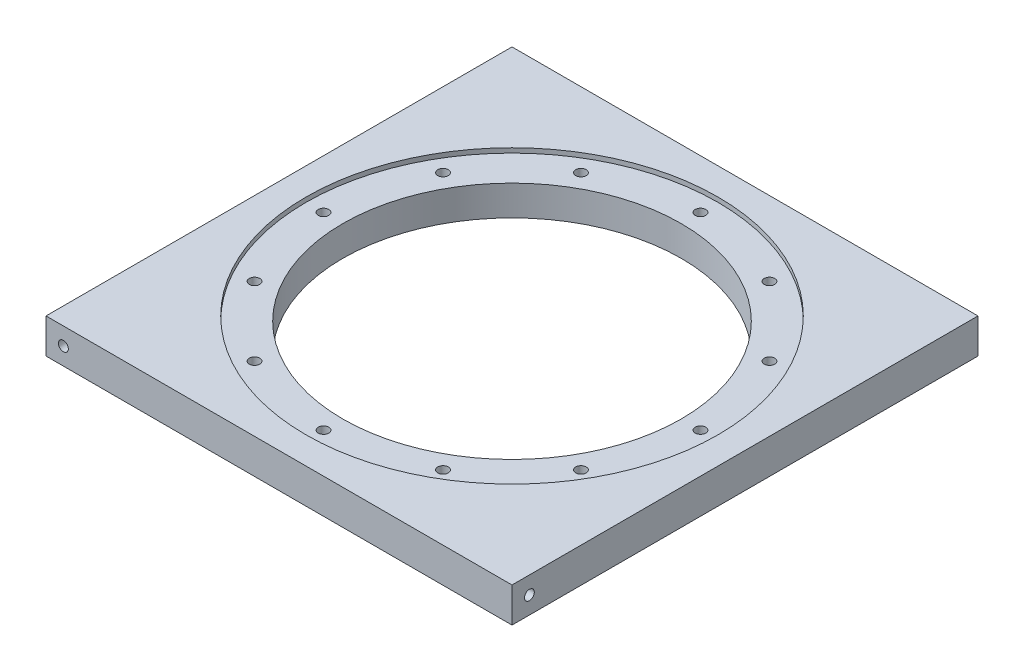
from build123d import *

# Parameters (mm, degrees)
SKETCH1_W           = 127.635
SKETCH1_H           = 127.635
BOSS_EXTRUDE1_DEPTH = 9.525
SKETCH6_R           = 1.35255
F_6_32_HOLE1_DEPTH  = 12.7
SKETCH7_R           = 1.35255
F_6_32_HOLE2_DEPTH  = 12.7
SKETCH8_R           = 1.35255
F_6_32_HOLE3_DEPTH  = 12.7
SKETCH9_R           = 1.35255
F_6_32_HOLE4_DEPTH  = 12.7
CUT_EXTRUDE1_DEPTH  = 9.525
SKETCH11_R          = 1.4351
CUT_EXTRUDE3_DEPTH  = 181.754286464
CIRPATTERN1_COUNT   = 12
SKETCH12_R          = 56.41975
CUT_EXTRUDE4_DEPTH  = 1.27


with BuildPart() as part:
    # Sketch1 → Boss-Extrude1 (new body)
    with BuildSketch(Plane(origin=(0, 0, 0), x_dir=(1, 0, 0), z_dir=(0, 1, 0))):
        with Locations((63.8175, 63.8175)):
            Rectangle(SKETCH1_W, SKETCH1_H)
    extrude(amount=BOSS_EXTRUDE1_DEPTH)

    # Sketch6 → 6-32 hole1 (cut)
    with BuildSketch(Plane(origin=(127.635, 0, 0), x_dir=(0, 0, -1), z_dir=(1, 0, 0))):
        with Locations((4.7625, 4.7625)):
            Circle(SKETCH6_R)
    extrude(amount=-F_6_32_HOLE1_DEPTH, mode=Mode.SUBTRACT)

    # Sketch7 → 6-32 hole2 (cut)
    with BuildSketch(Plane(origin=(0, 0, -127.635), x_dir=(-1, 0, 0), z_dir=(0, 0, -1))):
        with Locations((-122.8725, 4.7625)):
            Circle(SKETCH7_R)
    extrude(amount=-F_6_32_HOLE2_DEPTH, mode=Mode.SUBTRACT)

    # Sketch8 → 6-32 hole3 (cut)
    with BuildSketch(Plane.ZY):
        with Locations((-122.8725, 4.7625)):
            Circle(SKETCH8_R)
    extrude(amount=-F_6_32_HOLE3_DEPTH, mode=Mode.SUBTRACT)

    # Sketch9 → 6-32 hole4 (cut)
    with BuildSketch(Plane.XY):
        with Locations((4.7625, 4.7625)):
            Circle(SKETCH9_R)
    extrude(amount=-F_6_32_HOLE4_DEPTH, mode=Mode.SUBTRACT)

    # Sketch5 → Cut-Extrude1 (cut)
    with BuildSketch(Plane(origin=(0, 9.525, 0), x_dir=(1, 0, 0), z_dir=(0, 1, 0))):
        with BuildLine():
            ThreePointArc((63.8175, 110.1725), (17.4625, 63.8175), (63.8175, 17.4625))
            Line((63.8175, 17.4625), (63.8175, 110.1725))
        make_face()
        with BuildLine():
            Line((63.8175, 110.1725), (63.8175, 17.4625))
            ThreePointArc((63.8175, 17.4625), (96.595434842, 31.039565158), (110.1725, 63.8175))
            ThreePointArc((110.1725, 63.8175), (96.595434842, 96.595434842), (63.8175, 110.1725))
        make_face()
        with BuildLine():
            ThreePointArc((63.8175, 110.1725), (17.4625, 63.8175), (63.8175, 17.4625))
            Line((63.8175, 17.4625), (63.8175, 110.1725))
        make_face()
        with BuildLine():
            Line((63.8175, 110.1725), (63.8175, 17.4625))
            ThreePointArc((63.8175, 17.4625), (96.595434842, 31.039565158), (110.1725, 63.8175))
            ThreePointArc((110.1725, 63.8175), (96.595434842, 96.595434842), (63.8175, 110.1725))
        make_face()
    extrude(amount=-CUT_EXTRUDE1_DEPTH, mode=Mode.SUBTRACT)

    # Sketch11 → Cut-Extrude3 (cut, through all)
    with BuildSketch(Plane(origin=(0, 9.525, 0), x_dir=(1, 0, 0), z_dir=(0, 1, 0))):
        with Locations((63.8175, 115.443)):
            Circle(SKETCH11_R)
    cut_extrude3 = extrude(amount=-CUT_EXTRUDE3_DEPTH, mode=Mode.SUBTRACT)

    # CirPattern1: Cut-Extrude3 ×12 about axis
    cirpattern1_axis = Axis((63.8175, 9.525, -63.8175), (0, 1, 0))
    for i in range(1, CIRPATTERN1_COUNT):
        add(cut_extrude3.rotate(cirpattern1_axis, i * 360 / CIRPATTERN1_COUNT), mode=Mode.SUBTRACT)

    # Sketch12 → Cut-Extrude4 (cut)
    with BuildSketch(Plane(origin=(0, 9.525, 0), x_dir=(1, 0, 0), z_dir=(0, 1, 0))):
        with Locations((63.8175, 63.8175)):
            Circle(SKETCH12_R)
    extrude(amount=-CUT_EXTRUDE4_DEPTH, mode=Mode.SUBTRACT)


solid = part.part
